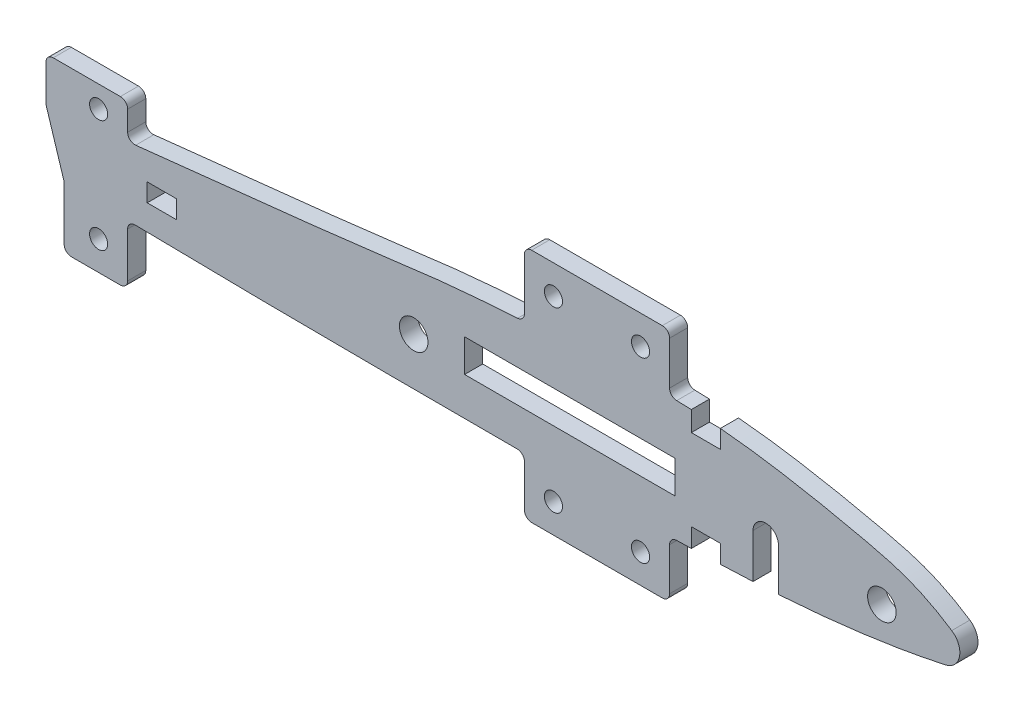
from build123d import *

# Parameters (mm, degrees)
BOSS_EXTRUDE1_DEPTH = 6.35
FILLET1_R           = 6.35
SKETCH2_W           = 50.8
SKETCH2_H           = 6.35
BOSS_EXTRUDE2_DEPTH = 19.05
SKETCH3_W           = 50.8
SKETCH3_H           = 6.35
BOSS_EXTRUDE3_DEPTH = 38.1
SKETCH4_W           = 50.8
SKETCH4_H           = 6.35
BOSS_EXTRUDE4_DEPTH = 63.5
FILLET2_R           = 2.54
SKETCH5_R           = 5
SKETCH5_W           = 73.66
SKETCH5_H           = 11.43
CUT_EXTRUDE3_DEPTH  = 284.408566149
SKETCH6_R           = 3.175
CUT_EXTRUDE4_DEPTH  = 284.408566149
SKETCH8_R           = 3.175
CUT_EXTRUDE5_DEPTH  = 284.408566149
CUT_EXTRUDE6_DEPTH  = 180.280400037
CAVITY1_START       = 73.557724966
CAVITY1_OUTLINE_W   = 7.669000427
CAVITY1_OUTLINE_H   = 6.35
CAVITY1_OUTLINE_W_2 = 8.842863075
CAVITY1_DEPTH       = 10.16
CAVITY1_START_2     = -116.877115344
CAVITY1_2_OUTLINE_W = 6.35
CAVITY1_2_OUTLINE_H = 6.35
CAVITY1_2_DEPTH     = 10.16


# Read off the part's stored shape, not the designer's step: Cavity1
with BuildPart() as part:
    # Sketch1 → Boss-Extrude1 (new body)
    with BuildSketch(Plane.XY):
        with BuildLine():
            add(Edge.make_bspline(
                [(-276.130119323, 8.693130358), (-231.459725957, 13.892182525), (-160.606907467, 22.045765928), (-55.21857633, 32.848239562), (-5.484684229, 39.5878223), (20.294760191, 40.734135472), (52.215253795, 43.311195196), (77.433370096, 43.854837121), (107.657853328, 39.590984865), (131.131357877, 34.766526999), (149.499224412, 30.294140301), (163.418705178, 23.059137739), (171.530279946, 16.921852673), (175.269753602, 13.29140622)],
                knots=[0, 0, 0, 0, 0.247403676, 0.462108507, 0.504395118, 0.627983171, 0.653401948, 0.743134379, 0.818760812, 0.882434425, 0.924179622, 0.96050512, 1, 1, 1, 1], degree=3))
            add(Edge.make_bspline(
                [(-276.130119323, 8.693130358), (-174.260953063, 0.911239157), (-23.669401798, 0.683864032), (127.515095646, 0.681371654), (175.269753602, 13.29140622)],
                knots=[0, 0, 0, 0, 0.67646369, 1, 1, 1, 1], degree=3))
        make_face()
    extrude(amount=BOSS_EXTRUDE1_DEPTH)

    # Fillet1
    fillet1_edges = [part.edges().sort_by_distance(p)[0] for p in [
        (175.269753602, 13.29140622, 3.175),
    ]]
    fillet(fillet1_edges, radius=FILLET1_R)

    # Sketch2 → Boss-Extrude2 (add, symmetric)
    with BuildSketch(Plane(origin=(0, 0, 0), x_dir=(1, 0, 0), z_dir=(0, 1, 0))):
        with Locations((-149.130119323, -3.175)):
            Rectangle(SKETCH2_W, SKETCH2_H)
        with Locations((40.537724966, -3.175)):
            Rectangle(SKETCH2_W, SKETCH2_H)
    extrude(amount=BOSS_EXTRUDE2_DEPTH, both=True)

    # Sketch3 → Boss-Extrude3 (add)
    with BuildSketch(Plane(origin=(0, 0, 0), x_dir=(1, 0, 0), z_dir=(0, 1, 0))):
        with Locations((-149.130119323, -3.175)):
            Rectangle(SKETCH3_W, SKETCH3_H)
    extrude(amount=BOSS_EXTRUDE3_DEPTH)

    # Sketch4 → Boss-Extrude4 (add)
    with BuildSketch(Plane(origin=(0, 0, 0), x_dir=(1, 0, 0), z_dir=(0, 1, 0))):
        with Locations((40.537724966, -3.175)):
            Rectangle(SKETCH4_W, SKETCH4_H)
    extrude(amount=BOSS_EXTRUDE4_DEPTH)

    # Fillet2
    fillet2_edges = [part.edges().sort_by_distance(p)[0] for p in [
        (65.937724966, 0.882409675, 3.175),
        (15.137724966, 0.715325792, 3.175),
        (-123.730119323, 1.809475424, 3.175),
        (-174.530119323, 3.18492072, 3.175),
        (-174.530119323, 20.264304266, 3.175),
        (-123.730119323, 25.734914395, 3.175),
        (15.137724966, 40.575893827, 3.175),
        (65.937724966, 43.322928246, 3.175),
        (65.937724966, -19.05, 3.175),
        (15.137724966, -19.05, 3.175),
        (-174.530119323, -19.05, 3.175),
        (-123.730119323, -19.05, 3.175),
        (-174.530119323, 38.1, 3.175),
        (-123.730119323, 38.1, 3.175),
        (65.937724966, 63.5, 3.175),
        (15.137724966, 63.5, 3.175),
    ]]
    fillet(fillet2_edges, radius=FILLET2_R)

    # Sketch5 → Cut-Extrude3 (cut, through all)
    with BuildSketch(Plane.XY):
        with Locations(Location((140.241842338, 17.410004614, 0), (0, 0, 180))):
            Circle(SKETCH5_R)
        with Locations(Location((-23.613557662, 17.410004614, 0), (0, 0, 180))):
            Circle(SKETCH5_R)
        with Locations((31.021842338, 19.812)):
            Rectangle(SKETCH5_W, SKETCH5_H)
    extrude(amount=CUT_EXTRUDE3_DEPTH, mode=Mode.SUBTRACT)

    # Sketch6 → Cut-Extrude4 (cut, through all)
    with BuildSketch(Plane.XY):
        with Locations(Location((55.777724966, 53.34, 0), (0, 0, 180))):
            Circle(SKETCH6_R)
        with Locations(Location((25.297724966, 53.34, 0), (0, 0, 180))):
            Circle(SKETCH6_R)
        with Locations(Location((55.777724966, -8.89, 0), (0, 0, 180))):
            Circle(SKETCH6_R)
        with Locations(Location((25.297724966, -8.89, 0), (0, 0, 180))):
            Circle(SKETCH6_R)
        with Locations(Location((-133.890119323, 30.48, 0), (0, 0, 180))):
            Circle(SKETCH6_R)
        with Locations(Location((-164.370119323, 30.48, 0), (0, 0, 180))):
            Circle(SKETCH6_R)
        with Locations(Location((-133.890119323, -8.89, 0), (0, 0, 180))):
            Circle(SKETCH6_R)
        with Locations(Location((-164.370119323, -8.89, 0), (0, 0, 180))):
            Circle(SKETCH6_R)
    extrude(amount=CUT_EXTRUDE4_DEPTH, mode=Mode.SUBTRACT)

    # Sketch8 → Cut-Extrude5 (cut, through all)
    with BuildSketch(Plane(origin=(0, 0, 0), x_dir=(-1, 0, 0), z_dir=(0, 0, -1))):
        with BuildLine():
            Line((152.305119323, 35.56), (152.305119323, 22.652979968))
            Line((152.305119323, 22.652979968), (145.955119323, 2.430574079))
            Line((145.955119323, 2.430574079), (145.955119323, -16.51))
            ThreePointArc((145.955119323, -16.51), (145.211170547, -18.306051224), (143.415119323, -19.05))
            Line((143.415119323, -19.05), (171.990119323, -19.05))
            ThreePointArc((171.990119323, -19.05), (173.786170547, -18.306051224), (174.530119323, -16.51))
            Line((174.530119323, -16.51), (174.530119323, 0.732669408))
            add(Edge.make_bspline(
                [(174.530119323, 0.732669408), (174.530119323, 0.827098892), (174.534332017, 0.922829058), (174.542975148, 1.019550557), (174.556231365, 1.116913443), (174.574237139, 1.214535389), (174.647171539, 1.525872583), (174.720530405, 1.739086636), (174.817987929, 1.947258959), (174.939041393, 2.145669731), (175.081636695, 2.329900504), (175.40320955, 2.663115508), (175.582254784, 2.812169869), (175.77623684, 2.94020009), (175.980813085, 3.044996297), (176.191284552, 3.125888304), (176.499832231, 3.209844277), (176.59675239, 3.231309016), (176.693582493, 3.24801799), (176.789935606, 3.260093994), (176.885455508, 3.26770712), (176.979825307, 3.271063977)],
                knots=[0, 0, 0, 0, 0, 0, 0, 0.156541714, 0.156541714, 0.156541714, 0.156541714, 0.156541714, 0.5, 0.5, 0.5, 0.5, 0.5, 0.843458286, 0.843458286, 0.843458286, 0.843458286, 0.843458286, 1, 1, 1, 1, 1, 1, 1], degree=6))
            add(Edge.make_bspline(
                [(276.130119323, 8.693130358), (243.083160763, 6.168638939), (210.036144296, 4.446920485), (176.979825307, 3.271063977)],
                knots=[0, 0, 0, 0, 0.219448812, 0.219448812, 0.219448812, 0.219448812], degree=3))
            add(Edge.make_bspline(
                [(276.130119323, 8.693130358), (241.143309206, 12.765139518), (210.289343773, 16.325674302), (176.792020475, 20.015402476)],
                knots=[0, 0, 0, 0, 0.193771865, 0.193771865, 0.193771865, 0.193771865], degree=3))
            add(Edge.make_bspline(
                [(176.792020475, 20.015402476), (176.702534659, 20.025259334), (176.612334841, 20.039047045), (176.521708613, 20.056916996), (176.430972739, 20.078987549), (176.340465644, 20.105336292), (176.052123832, 20.203632982), (175.856494206, 20.292258021), (175.667511078, 20.402173666), (175.489198081, 20.532546831), (175.325208173, 20.681273314), (175.070618463, 20.965445878), (174.972096017, 21.093854031), (174.883813086, 21.22927413), (174.806550855, 21.370274525), (174.740735934, 21.515302785), (174.633101241, 21.807741296), (174.590880763, 21.955079167), (174.559863739, 22.103342362), (174.539790441, 22.251097449), (174.530119323, 22.397057265), (174.530119323, 22.540132369)],
                knots=[0, 0, 0, 0, 0, 0, 0, 0.155935083, 0.155935083, 0.155935083, 0.155935083, 0.155935083, 0.499997058, 0.499997058, 0.499997058, 0.499997058, 0.499997058, 0.752183878, 0.752183878, 0.752183878, 0.752183878, 0.752183878, 1, 1, 1, 1, 1, 1, 1], degree=6))
            Line((174.530119323, 22.540132369), (174.530119323, 35.56))
            ThreePointArc((174.530119323, 35.56), (173.786170547, 37.356051224), (171.990119323, 38.1))
            Line((171.990119323, 38.1), (149.765119323, 38.1))
            ThreePointArc((149.765119323, 38.1), (151.561170547, 37.356051224), (152.305119323, 35.56))
        make_face()
        with Locations((164.370119323, -8.89)):
            Circle(SKETCH8_R, mode=Mode.SUBTRACT)
        with Locations((164.370119323, 30.48)):
            Circle(SKETCH8_R, mode=Mode.SUBTRACT)
    extrude(amount=-CUT_EXTRUDE5_DEPTH, mode=Mode.SUBTRACT)

    # Sketch10 → Cut-Extrude6 (cut, through all)
    with BuildSketch(Plane(origin=(0, 0, 0), x_dir=(-1, 0, 0), z_dir=(0, 0, -1))):
        with BuildLine():
            Line((-95.157002323, 17.295971295), (-95.157002323, 1.810619129))
            add(Edge.make_bspline(
                [(-95.157002323, 1.810619129), (-98.122222912, 1.963522837), (-101.08564833, 2.137394625), (-104.047002323, 2.335082223)],
                knots=[0.821015806, 0.821015806, 0.821015806, 0.821015806, 0.840729968, 0.840729968, 0.840729968, 0.840729968], degree=3))
            Line((-104.047002323, 2.335082223), (-104.047002323, 17.295971295))
            ThreePointArc((-104.047002323, 17.295971295), (-99.602002323, 21.740971295), (-95.157002323, 17.295971295))
        make_face()
    extrude(amount=-CUT_EXTRUDE6_DEPTH, mode=Mode.SUBTRACT)

    # Cavity1 outline → Cavity1 (cut)
    with BuildSketch(Plane.YZ.offset(CAVITY1_START)):
        with Locations((3.834500214, 3.175)):
            Rectangle(CAVITY1_OUTLINE_W, CAVITY1_OUTLINE_H)
        with Locations((40.578568463, 3.175)):
            Rectangle(CAVITY1_OUTLINE_W_2, CAVITY1_OUTLINE_H)
    extrude(amount=CAVITY1_DEPTH, mode=Mode.SUBTRACT)

    # Cavity1 2 outline → Cavity1 2 (cut)
    with BuildSketch(Plane.YZ.offset(CAVITY1_START_2)):
        with Locations((13.763428416, 3.175)):
            Rectangle(CAVITY1_2_OUTLINE_W, CAVITY1_2_OUTLINE_H)
    extrude(amount=CAVITY1_2_DEPTH, mode=Mode.SUBTRACT)


solid = part.part
